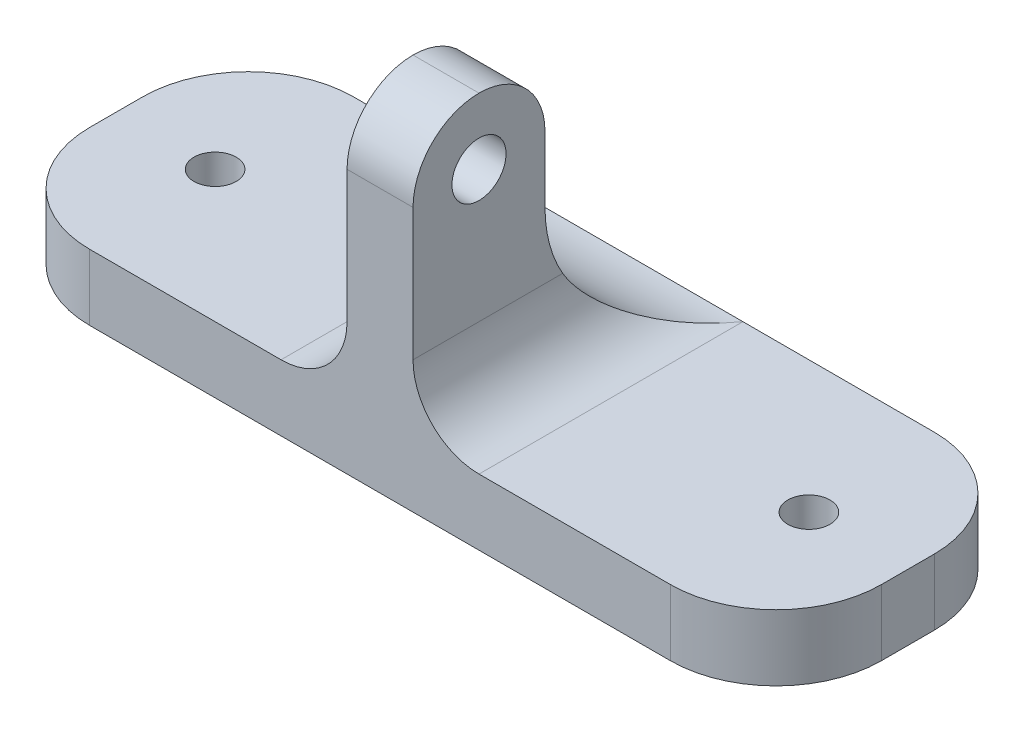
from build123d import *

# Parameters (mm, degrees)
SKETCH_1_W          = 20
SKETCH_1_H          = 15
EXTRUDE_1_DEPTH     = 10
SKETCH_2_W          = 60
SKETCH_2_H          = 20
EXTRUDE_2_DEPTH     = 5
SKETCH_3_R          = 1.6
CUT_EXTRUDE_1_DEPTH = 21
FILLET_1_R          = 8
SKETCH_6_W          = 20
SKETCH_6_H          = 10
CUT_EXTRUDE_3_DEPTH = 10
SKETCH_7_W          = 5
SKETCH_7_H          = 10
EXTRUDE_4_DEPTH     = 20
SKETCH_8_R          = 2.05
CUT_EXTRUDE_4_DEPTH = 20
FILLET_2_R          = 5
FILLET_3_R          = 10
FILLET_4_R          = 5


with BuildPart() as part:
    # 草图1 → 凸台-拉伸1 (new body)
    with BuildSketch(Plane.XY):
        with Locations((10, 7.5)):
            Rectangle(SKETCH_1_W, SKETCH_1_H)
    extrude(amount=EXTRUDE_1_DEPTH)

    # 草图2 → 凸台-拉伸2 (add)
    with BuildSketch(Plane.XZ):
        with Locations((10, 0)):
            Rectangle(SKETCH_2_W, SKETCH_2_H)
    extrude(amount=-EXTRUDE_2_DEPTH)

    # 草图3 → 切除-拉伸1 (cut)
    with BuildSketch(Plane.XZ):
        with Locations(Location((-12.5, 0, 0), (0, 0, 270))):
            Circle(SKETCH_3_R)
        with Locations(Location((32.5, 0, 0), (0, 0, 270))):
            Circle(SKETCH_3_R)
    extrude(amount=-CUT_EXTRUDE_1_DEPTH, mode=Mode.SUBTRACT)

    # 圆角1
    fillet_1_edges = [part.edges().sort_by_distance(p)[0] for p in [
        (-20, 2.5, 10),
        (-20, 2.5, -10),
        (40, 2.5, 10),
        (40, 2.5, -10),
    ]]
    fillet(fillet_1_edges, radius=FILLET_1_R)

    # 草图6 → 切除-拉伸3 (cut)
    with BuildSketch(Plane(origin=(0, 15, 0), x_dir=(1, 0, 0), z_dir=(0, 1, 0))):
        with Locations((10, -5)):
            Rectangle(SKETCH_6_W, SKETCH_6_H)
    extrude(amount=-CUT_EXTRUDE_3_DEPTH, mode=Mode.SUBTRACT)

    # 草图7 → 凸台-拉伸4 (add)
    with BuildSketch(Plane(origin=(0, 5, 0), x_dir=(1, 0, 0), z_dir=(0, 1, 0))):
        with Locations((10, -5)):
            Rectangle(SKETCH_7_W, SKETCH_7_H)
    extrude(amount=EXTRUDE_4_DEPTH)

    # 草图8 → 切除-拉伸4 (cut)
    with BuildSketch(Plane.ZY.offset(-7.5)):
        with Locations((5, 20)):
            Circle(SKETCH_8_R)
    extrude(amount=-CUT_EXTRUDE_4_DEPTH, mode=Mode.SUBTRACT)

    # 圆角2
    fillet_2_edges = [part.edges().sort_by_distance(p)[0] for p in [
        (10, 25, 0),
        (10, 25, 10),
    ]]
    fillet(fillet_2_edges, radius=FILLET_2_R - 0.0001)  # a hair under: the kernel refuses the full size

    # 圆角3
    fillet_3_edges = [part.edges().sort_by_distance(p)[0] for p in [
        (10, 5, 0),
    ]]
    fillet(fillet_3_edges, radius=FILLET_3_R - 0.0001)  # a hair under: the kernel refuses the full size

    # 圆角4
    fillet_4_edges = [part.edges().sort_by_distance(p)[0] for p in [
        (7.5, 5, 5e-05),
        (12.5, 5, 5e-05),
    ]]
    fillet(fillet_4_edges, radius=FILLET_4_R)


solid = part.part
